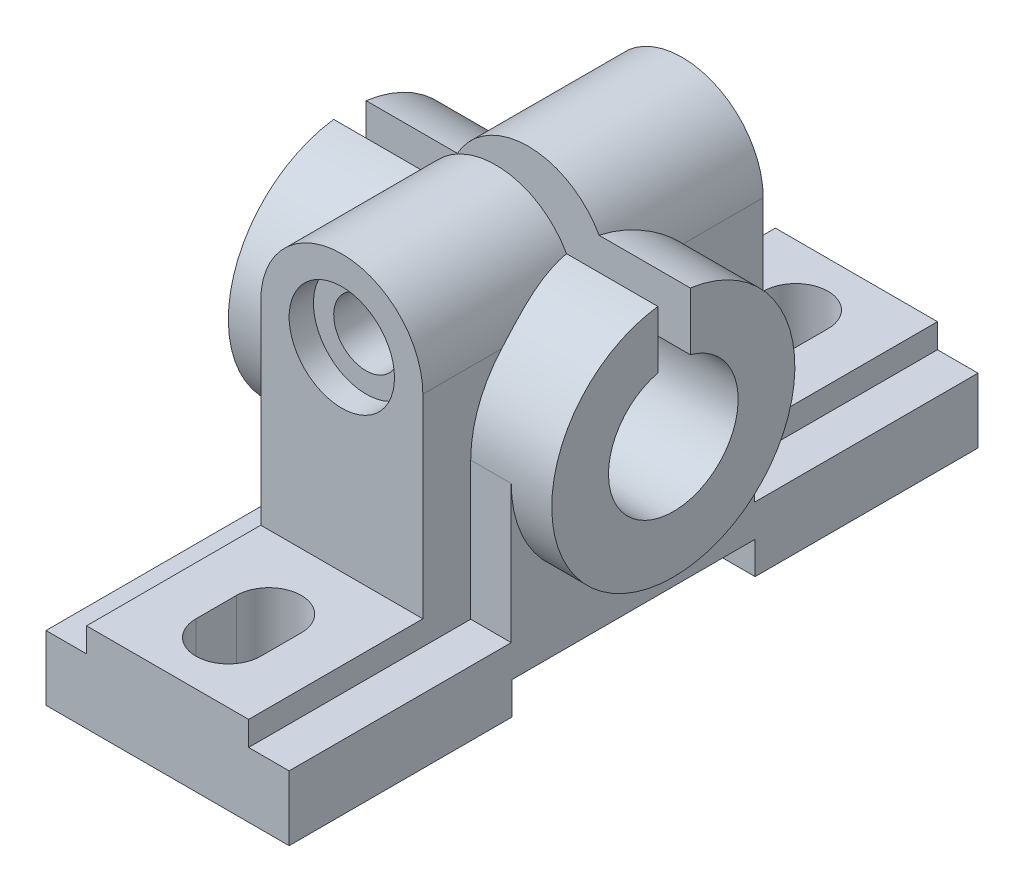
from build123d import *

# Parameters (mm, degrees)
EXTRUDE_1_DEPTH           = 85
EXTRUDE_2_DEPTH           = 42
SKETCH_3_W                = 30
SKETCH_3_H                = 4
CUT_EXTRUDE_1_DEPTH       = 42
CUT_EXTRUDE_2_DEPTH       = 42
SKETCH_17_R               = 6.5
CUT_EXTRUDE_5_DEPTH       = 3
CUT_EXTRUDE_START         = -3
SKETCH_19_R               = 6.5
CUT_EXTRUDE_6_DEPTH       = 3
SKETCH_20_R               = 4
CUT_EXTRUDE_7_DEPTH       = 85
EXTRUDE_7_REACH           = 104.603
EXTRUDE_8_REACH           = 104.603
EXTRUDE_START             = 5
SKETCH_28_R               = 15
EXTRUDE_9_DEPTH           = 5
SKETCH_31_R               = 15
EXTRUDE_13_DEPTH          = 5
SKETCH_32_R               = 8
CUT_EXTRUDE_8_DEPTH       = 106.959277564
CUT_EXTRUDE_10_DEPTH      = 15
CUT_EXTRUDE_10_DEPTH_BACK = 105.174701827
SKETCH_33_W               = 4
SKETCH_33_H               = 26.351351119


with BuildPart() as part:
    # 草图1 → 凸台-拉伸1 (new body)
    with BuildSketch(Plane.XY):
        Polygon((1.27694859, 12.013962133), (-3.72305141, 12.013962133), (-3.72305141, 4.013962133), (26.27694859, 4.013962133), (26.27694859, 12.013962133), (21.27694859, 12.013962133), (21.27694859, 15.013962133), (1.27694859, 15.013962133), align=None)
    extrude(amount=-EXTRUDE_1_DEPTH)

    # 草图4 → 凸台-拉伸2 (add)
    with BuildSketch(Plane.XY.offset(-21.5)):
        with BuildLine():
            Line((1.27694859, 15.013962133), (21.27694859, 15.013962133))
            Line((21.27694859, 15.013962133), (21.27694859, 39.013962133))
            ThreePointArc((21.27694859, 39.013962133), (11.27694859, 49.013962133), (1.27694859, 39.013962133))
            Line((1.27694859, 39.013962133), (1.27694859, 15.013962133))
        make_face()
    extrude(amount=-EXTRUDE_2_DEPTH)

    # 草图3 → 切除-拉伸1 (cut)
    with BuildSketch(Plane(origin=(26.27694859, 0, 0), x_dir=(0, 0, -1), z_dir=(1, 0, 0))):
        with Locations((42.5, 6.013962133)):
            Rectangle(SKETCH_3_W, SKETCH_3_H)
    extrude(amount=-CUT_EXTRUDE_1_DEPTH, mode=Mode.SUBTRACT)

    # 草图2 → 切除-拉伸2 (cut)
    with BuildSketch(Plane(origin=(0, 15.013962133, 0), x_dir=(1, 0, 0), z_dir=(0, 1, 0))):
        with BuildLine():
            Line((7.27694859, 12.5), (7.27694859, 7.5))
            ThreePointArc((7.27694859, 7.5), (11.27694859, 3.5), (15.27694859, 7.5))
            Line((15.27694859, 7.5), (15.27694859, 12.5))
            ThreePointArc((15.27694859, 12.5), (11.27694859, 16.5), (7.27694859, 12.5))
        make_face()
        with BuildLine():
            Line((7.27694859, 77.5), (7.27694859, 72.5))
            ThreePointArc((7.27694859, 72.5), (11.27694859, 68.5), (15.27694859, 72.5))
            Line((15.27694859, 72.5), (15.27694859, 77.5))
            ThreePointArc((15.27694859, 77.5), (11.27694859, 81.5), (7.27694859, 77.5))
        make_face()
    extrude(amount=-CUT_EXTRUDE_2_DEPTH, mode=Mode.SUBTRACT)

    # 草图17 → 切除-拉伸5 (cut)
    with BuildSketch(Plane.XY.offset(-21.5)):
        with Locations((11.27694859, 39.013962133)):
            Circle(SKETCH_17_R)
    extrude(amount=-CUT_EXTRUDE_5_DEPTH, mode=Mode.SUBTRACT)

    # 草图19 → 切除-拉伸6 (cut)
    with BuildSketch(Plane(origin=(0, 0, -63.5), x_dir=(-1, 0, 0), z_dir=(0, 0, -1)).offset(CUT_EXTRUDE_START)):
        with Locations((-11.27694859, 39.013962133)):
            Circle(SKETCH_19_R)
    extrude(amount=CUT_EXTRUDE_6_DEPTH, mode=Mode.SUBTRACT)

    # 草图20 → 切除-拉伸7 (cut)
    with BuildSketch(Plane(origin=(0, 0, -60.5), x_dir=(-1, 0, 0), z_dir=(0, 0, -1))):
        with Locations((-11.27694859, 39.013962133)):
            Circle(SKETCH_20_R)
    extrude(amount=-CUT_EXTRUDE_7_DEPTH, mode=Mode.SUBTRACT)

    # 草图26 → 凸台-拉伸7 (add, up to next)
    with BuildSketch(Plane(origin=(26.27694859, 0, 0), x_dir=(0, 0, -1), z_dir=(1, 0, 0)), mode=Mode.PRIVATE) as extrude_7_sk1:
        with BuildLine():
            Line((27.405245535, 12.013962133), (57.405245535, 12.013962133))
            Line((57.405245535, 12.013962133), (57.405245535, 29.013962133))
            ThreePointArc((57.405245535, 29.013962133), (42.405245535, 44.013962133), (27.405245535, 29.013962133))
            Line((27.405245535, 29.013962133), (27.405245535, 12.013962133))
        make_face()
    extrude_7_tool1 = extrude(extrude_7_sk1.sketch, amount=-EXTRUDE_7_REACH, mode=Mode.PRIVATE) - part.part
    add(extrude_7_tool1.solids().sort_by_distance((26.276949, 26.599172, -42.405246))[0])

    # 草图27 → 凸台-拉伸8 (add, up to next)
    with BuildSketch(Plane.ZY.offset(3.72305141), mode=Mode.PRIVATE) as extrude_8_sk1:
        with BuildLine():
            Line((-57.5, 12.013962133), (-27.5, 12.013962133))
            Line((-27.5, 12.013962133), (-27.5, 29.013962133))
            ThreePointArc((-27.5, 29.013962133), (-42.5, 44.013962133), (-57.5, 29.013962133))
            Line((-57.5, 29.013962133), (-57.5, 12.013962133))
        make_face()
    extrude_8_tool1 = extrude(extrude_8_sk1.sketch, amount=-EXTRUDE_8_REACH, mode=Mode.PRIVATE) - part.part
    add(extrude_8_tool1.solids().sort_by_distance((-3.723051, 26.599172, -42.5))[0])

    # 草图28 → 凸台-拉伸9 (add)
    with BuildSketch(Plane(origin=(26.27694859, 0, 0), x_dir=(0, 0, -1), z_dir=(1, 0, 0)).offset(EXTRUDE_START)):
        with Locations((42.405245535, 29.013962133)):
            Circle(SKETCH_28_R)
    extrude(amount=-EXTRUDE_9_DEPTH)

    # 草图31 → 凸台-拉伸13 (add)
    with BuildSketch(Plane.ZY.offset(3.72305141).offset(EXTRUDE_START)):
        with Locations((-42.5, 29.013962133)):
            Circle(SKETCH_31_R)
    extrude(amount=-EXTRUDE_13_DEPTH)

    # 草图32 → 切除-拉伸8 (cut, through all)
    with BuildSketch(Plane(origin=(31.27694859, 0, 0), x_dir=(0, 0, -1), z_dir=(1, 0, 0))):
        with Locations((42.405245535, 29.013962133)):
            Circle(SKETCH_32_R)
    extrude(amount=-CUT_EXTRUDE_8_DEPTH, mode=Mode.SUBTRACT)

    # 草图33 → 切除-拉伸10 (cut, two sides: drawn at the far end of the back side and taken through both)
    with BuildSketch(Plane(origin=(26.27694859, 0, 0), x_dir=(0, 0, -1), z_dir=(1, 0, 0)).offset(-CUT_EXTRUDE_10_DEPTH_BACK)):
        with Locations((42.5, 39.013962134)):
            Rectangle(SKETCH_33_W, SKETCH_33_H)
    extrude(amount=CUT_EXTRUDE_10_DEPTH + CUT_EXTRUDE_10_DEPTH_BACK, mode=Mode.SUBTRACT)


solid = part.part
